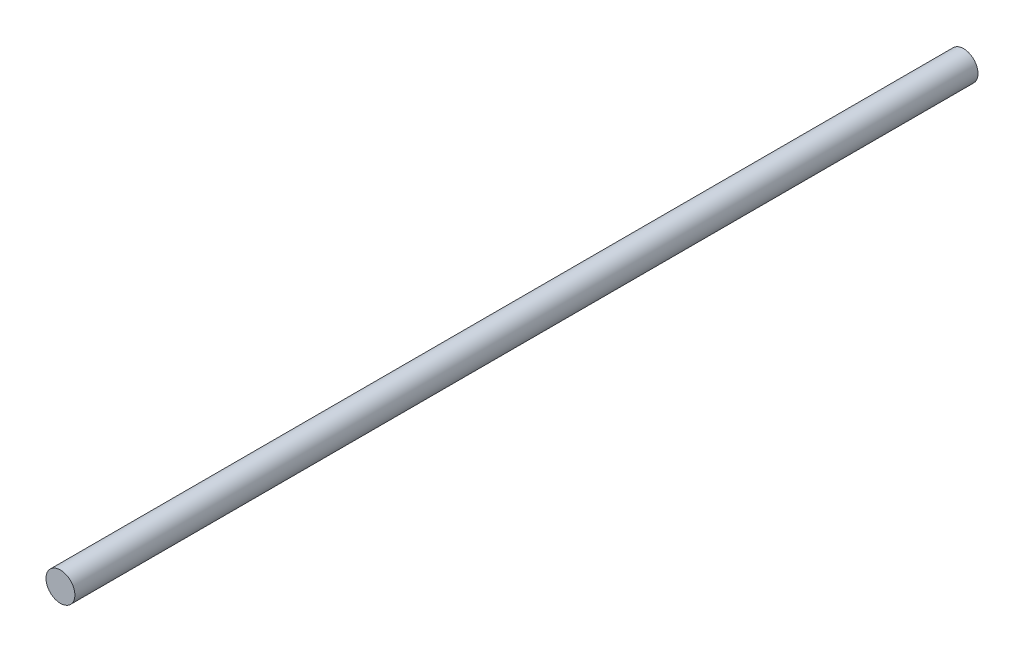
from build123d import *

# Parameters (mm, degrees)
SKETCH1_W = 4
SKETCH1_H = 250


with BuildPart() as part:
    # Sketch1 → Revolve1 (revolve)
    with BuildSketch(Plane(origin=(0, 0, 0), x_dir=(1, 0, 0), z_dir=(0, 1, 0))):
        with Locations((-2, -125)):
            Rectangle(SKETCH1_W, SKETCH1_H)
    revolve(axis=Axis((0, 0, 48.709374581), (0, 0, -1)))


solid = part.part
